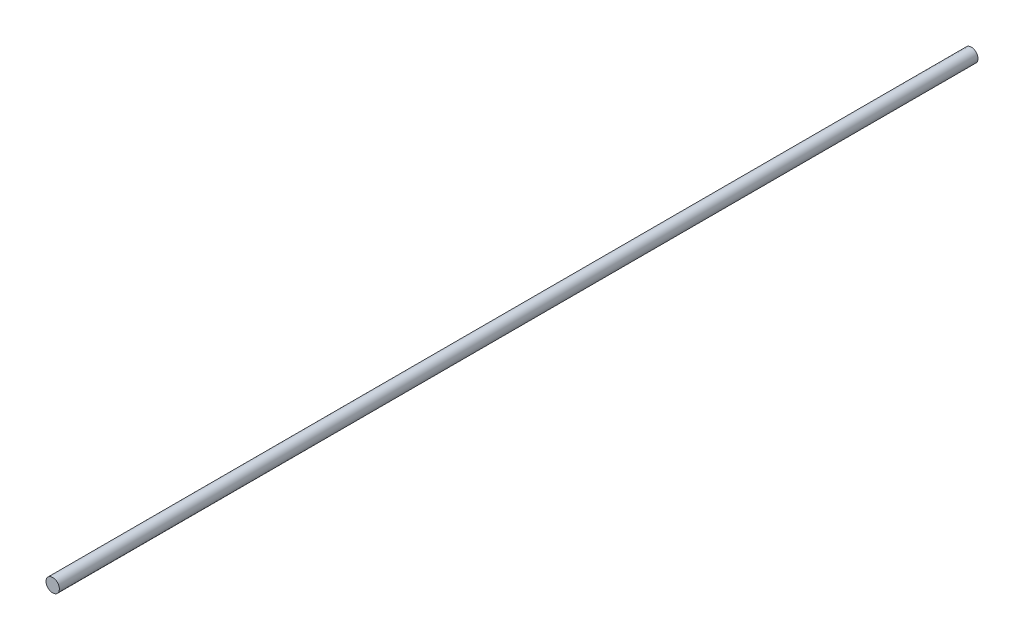
from build123d import *

# Parameters (mm, degrees)
SKICA1_R                = 4
P_IDAT_VYSUNUT_M1_DEPTH = 550


with BuildPart() as part:
    # Skica1 → Přidat vysunutím1 (new body)
    with BuildSketch(Plane.XY):
        Circle(SKICA1_R)
    extrude(amount=P_IDAT_VYSUNUT_M1_DEPTH)


solid = part.part
